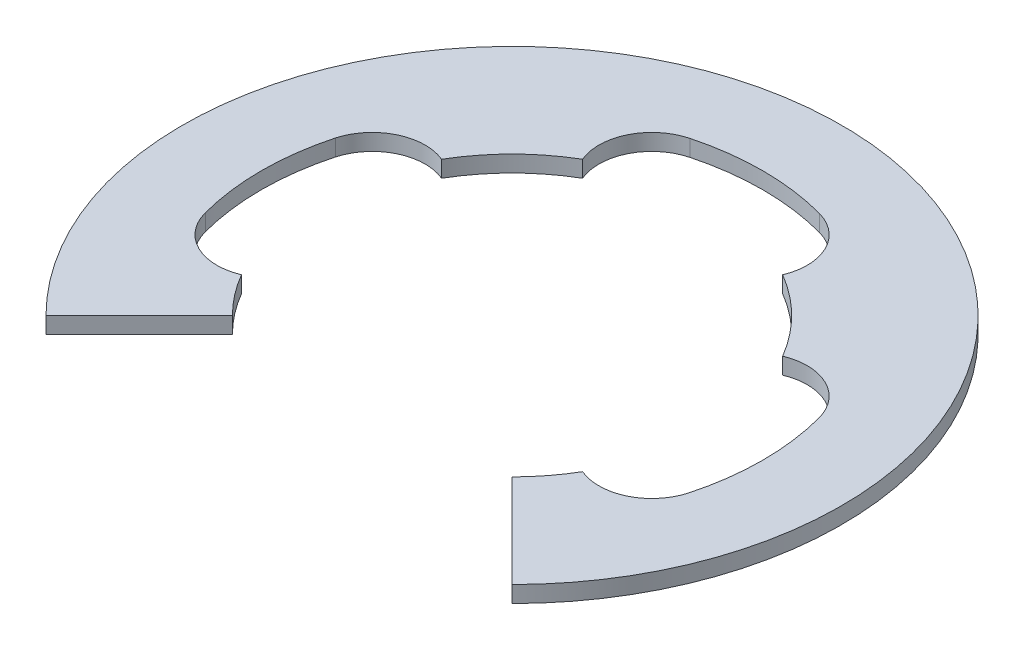
from build123d import *

# Parameters (mm, degrees)
SKETCH2_R                    = 15.875
BOSS_EXTRUDE1_DEPTH          = 0.79375
SKETCH3_R                    = 9.525
CUT_EXTRUDE1_DEPTH           = 23.464667571
SKETCH4_W                    = 22.318168974
SKETCH4_H                    = 8.357131245
CUT_REVOLVE1_ANGLE           = 45
CUT_REVOLVE1_OTHER_WAY_ANGLE = 45
CUT_EXTRUDE2_DEPTH           = 23.464667571
CIRPATTERN1_COUNT            = 4


with BuildPart() as part:
    # Sketch2 → Boss-Extrude1 (new body)
    with BuildSketch(Plane(origin=(0, 0, 0), x_dir=(1, 0, 0), z_dir=(0, 1, 0))):
        Circle(SKETCH2_R)
    extrude(amount=BOSS_EXTRUDE1_DEPTH)

    # Sketch3 → Cut-Extrude1 (cut, through all)
    with BuildSketch(Plane(origin=(0, 0.79375, 0), x_dir=(1, 0, 0), z_dir=(0, 1, 0))):
        Circle(SKETCH3_R)
    extrude(amount=-CUT_EXTRUDE1_DEPTH, mode=Mode.SUBTRACT)

    # Sketch4 → Cut-Revolve1 (revolve, cut)
    with BuildSketch(Plane(origin=(0, 0, 0), x_dir=(0, 0, -1), z_dir=(1, 0, 0))):
        with Locations((-11.159084487, 3.258563731)):
            Rectangle(SKETCH4_W, SKETCH4_H)
    revolve(axis=Axis((0, -0.920001892, 0), (0, 1, 0)), revolution_arc=CUT_REVOLVE1_ANGLE, mode=Mode.SUBTRACT)

    # Sketch4 → Cut-Revolve1 other way (revolve, cut)
    with BuildSketch(Plane(origin=(0, 0, 0), x_dir=(0, 0, -1), z_dir=(1, 0, 0))):
        with Locations((-11.159084487, 3.258563731)):
            Rectangle(SKETCH4_W, SKETCH4_H)
    revolve(axis=Axis((0, -0.920001892, 0), (0, -1, 0)), revolution_arc=CUT_REVOLVE1_OTHER_WAY_ANGLE, mode=Mode.SUBTRACT)

    # Sketch5 → Cut-Extrude2 (cut, through all)
    with BuildSketch(Plane(origin=(0, 0.79375, 0), x_dir=(1, 0, 0), z_dir=(0, 1, 0))):
        with BuildLine():
            ThreePointArc((6.735130017, 1.804675698), (6.972719879, 1.524e-06), (6.735130017, -1.804672649))
            ThreePointArc((6.735130017, -1.804672649), (8.526340239, -4.926901184), (11.658355383, -3.152858844))
            ThreePointArc((11.658355383, -3.152858844), (12.077126673, -0.028021852), (11.67286135, 3.098724887))
            ThreePointArc((11.67286135, 3.098724887), (8.55340915, 4.934157326), (6.735130017, 1.804675698))
        make_face()
    cut_extrude2 = extrude(amount=-CUT_EXTRUDE2_DEPTH, mode=Mode.SUBTRACT)

    # CirPattern1: Cut-Extrude2 ×4 about axis
    cirpattern1_axis = Axis((0, 0, 0), (0, 1, 0))
    for i in range(1, CIRPATTERN1_COUNT):
        add(cut_extrude2.rotate(cirpattern1_axis, i * 360 / CIRPATTERN1_COUNT), mode=Mode.SUBTRACT)


solid = part.part
